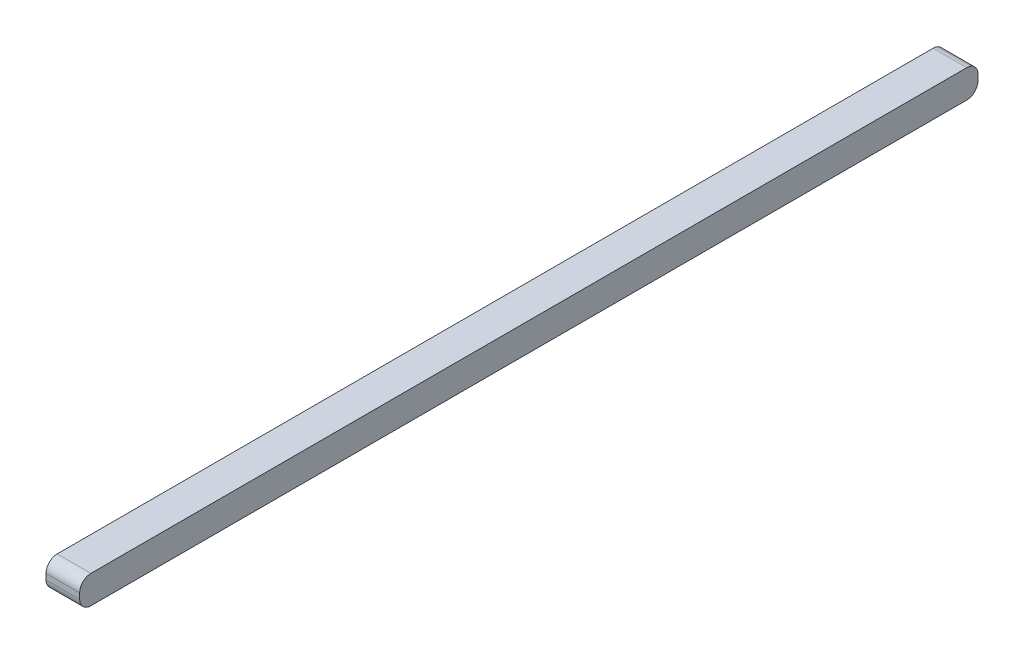
from build123d import *

# Parameters (mm, degrees)
BOSS_EXTRUDE1_START = -6
BOSS_EXTRUDE1_DEPTH = 6


with BuildPart() as part:
    # Boss-Extrude1: read off the stored shape, not the designer's step
    # Boss-Extrude1 outline → Boss-Extrude1 (new body)
    with BuildSketch(Plane(origin=(0, 22.5, 0), x_dir=(0, 0, -1), z_dir=(1, 0, 0)).offset(BOSS_EXTRUDE1_START)):
        with BuildLine():
            Line((-80, 3), (-80, 2))
            ThreePointArc((-80, 2), (-79.414213562, 0.585786438), (-78, 0))
            Line((-78, 0), (78, 0))
            ThreePointArc((78, 0), (79.414213562, 0.585786438), (80, 2))
            Line((80, 2), (80, 3))
            ThreePointArc((80, 3), (79.414213562, 4.414213562), (78, 5))
            Line((78, 5), (-78, 5))
            ThreePointArc((-78, 5), (-79.414213562, 4.414213562), (-80, 3))
        make_face()
    extrude(amount=BOSS_EXTRUDE1_DEPTH)


solid = part.part
